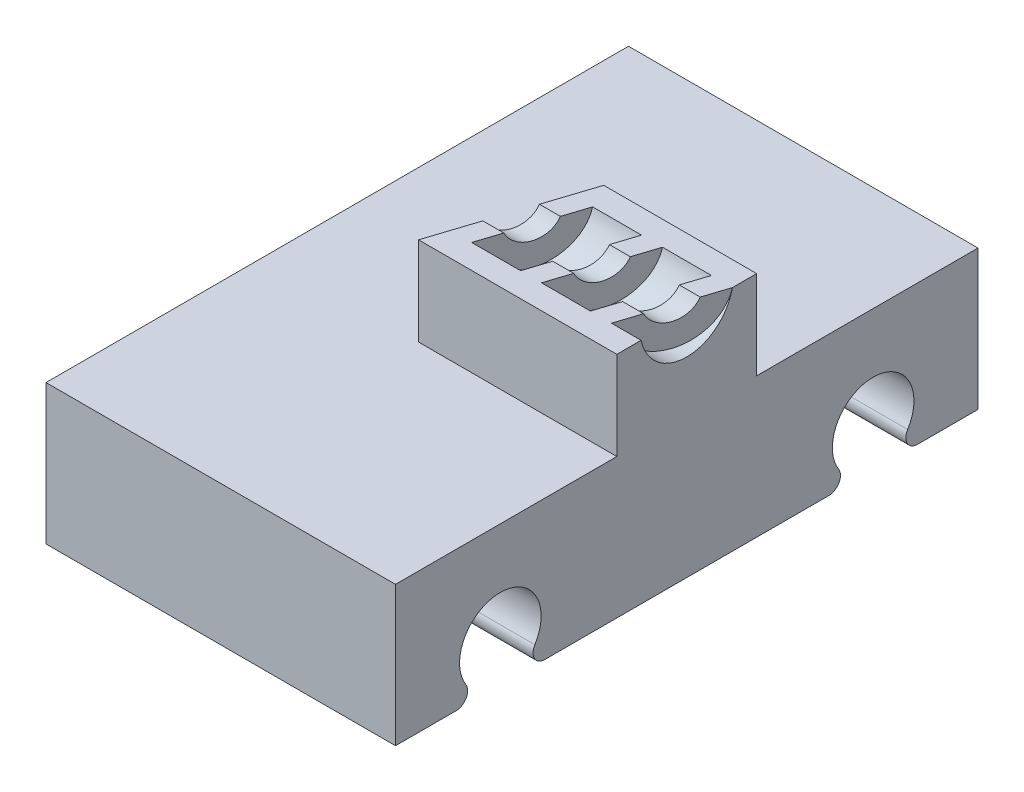
from build123d import *

# Parameters (mm, degrees)
SKETCH_1_W          = 15
SKETCH_1_H          = 25
EXTRUDE_1_DEPTH     = 6
SKETCH_3_R          = 1.75
CUT_EXTRUDE_1_DEPTH = 15
FILLET_1_R          = 0.5
SKETCH_4_W          = 15
SKETCH_4_H          = 6
EXTRUDE_3_DEPTH     = 2.2
EXTRUDE_4_DEPTH     = 15
EXTRUDE_5_REACH     = 32.758
CUT_EXTRUDE_2_REACH = 32.758
SKETCH_8_R          = 1
CUT_EXTRUDE_START   = 6
CUT_EXTRUDE_3_DEPTH = 3.8
SKETCH_10_W         = 8
SKETCH_10_H         = 3.806573262
CUT_EXTRUDE_5_DEPTH = 5
SKETCH_12_R         = 0.9
CUT_EXTRUDE_7_DEPTH = 4


# Read off the part's stored shape, not the designer's step: 切除-拉伸3
with BuildPart() as part:
    # 草图1 → 凸台-拉伸1 (new body)
    with BuildSketch(Plane(origin=(0, 0, 0), x_dir=(1, 0, 0), z_dir=(0, 1, 0))):
        with Locations((7.5, -12.5)):
            Rectangle(SKETCH_1_W, SKETCH_1_H)
    extrude(amount=EXTRUDE_1_DEPTH)

    # 草图3 → 切除-拉伸1 (cut)
    with BuildSketch(Plane(origin=(15, 0, 0), x_dir=(0, 0, -1), z_dir=(1, 0, 0))):
        with Locations((-20.5, 1.7)):
            Circle(SKETCH_3_R)
        with Locations((-4.5, 1.7)):
            Circle(SKETCH_3_R)
    extrude(amount=-CUT_EXTRUDE_1_DEPTH, mode=Mode.SUBTRACT)

    # 圆角1
    fillet_1_edges = [part.edges().sort_by_distance(p)[0] for p in [
        (7.5, 0, 4.084668807),
        (7.5, 0, 4.915331193),
        (7.5, 0, 20.084668807),
        (7.5, 0, 20.915331193),
    ]]
    fillet(fillet_1_edges, radius=FILLET_1_R)

    # 草图4 → 凸台-拉伸3 (add)
    with BuildSketch(Plane(origin=(0, 6, 0), x_dir=(1, 0, 0), z_dir=(0, 1, 0))):
        with Locations((7.5, -12.5)):
            Rectangle(SKETCH_4_W, SKETCH_4_H)
    extrude(amount=EXTRUDE_3_DEPTH)

    # 草图6 → 凸台-拉伸4 (add)
    with BuildSketch(Plane(origin=(15, 0, 0), x_dir=(0, 0, -1), z_dir=(1, 0, 0))):
        with BuildLine():
            ThreePointArc((-10.540408206, 9.8), (-11.235088936, 8.650806662), (-12.5, 8.2))
            Line((-12.5, 8.2), (-9.5, 8.2))
            Line((-9.5, 8.2), (-9.5, 9.8))
            Line((-9.5, 9.8), (-10.540408206, 9.8))
        make_face()
        with BuildLine():
            Line((-15.5, 9.8), (-15.5, 8.2))
            Line((-15.5, 8.2), (-12.5, 8.2))
            ThreePointArc((-12.5, 8.2), (-13.764911064, 8.650806662), (-14.459591794, 9.8))
            Line((-14.459591794, 9.8), (-15.5, 9.8))
        make_face()
    extrude(amount=-EXTRUDE_4_DEPTH)

    # 草图7 → 凸台-拉伸5 (add, up to next)
    with BuildSketch(Plane(origin=(0, 9.8, 0), x_dir=(1, 0, 0), z_dir=(0, 1, 0)), mode=Mode.PRIVATE) as extrude_5_sk1:
        Polygon((14.1, -10.540408206), (15, -10.540408206), (13.726580059, -14.459591794), (12.826580059, -14.459591794), align=None)
    extrude_5_tool1 = extrude(extrude_5_sk1.sketch, amount=-EXTRUDE_5_REACH, mode=Mode.PRIVATE) - part.part
    # 草图7 → 凸台-拉伸5 (add, up to next)
    with BuildSketch(Plane(origin=(0, 9.8, 0), x_dir=(1, 0, 0), z_dir=(0, 1, 0)), mode=Mode.PRIVATE) as extrude_5_sk2:
        Polygon((11.1, -10.540408206), (12, -10.540408206), (10.726580059, -14.459591794), (9.826580059, -14.459591794), align=None)
    extrude_5_tool2 = extrude(extrude_5_sk2.sketch, amount=-EXTRUDE_5_REACH, mode=Mode.PRIVATE) - part.part
    # 草图7 → 凸台-拉伸5 (add, up to next)
    with BuildSketch(Plane(origin=(0, 9.8, 0), x_dir=(1, 0, 0), z_dir=(0, 1, 0)), mode=Mode.PRIVATE) as extrude_5_sk3:
        Polygon((8.1, -10.540408206), (9, -10.540408206), (7.726580059, -14.459591794), (6.826580059, -14.459591794), align=None)
    extrude_5_tool3 = extrude(extrude_5_sk3.sketch, amount=-EXTRUDE_5_REACH, mode=Mode.PRIVATE) - part.part
    # 草图7 → 凸台-拉伸5 (add, up to next)
    with BuildSketch(Plane(origin=(0, 9.8, 0), x_dir=(1, 0, 0), z_dir=(0, 1, 0)), mode=Mode.PRIVATE) as extrude_5_sk4:
        Polygon((5.1, -10.540408206), (6, -10.540408206), (4.726580059, -14.459591794), (3.826580059, -14.459591794), align=None)
    extrude_5_tool4 = extrude(extrude_5_sk4.sketch, amount=-EXTRUDE_5_REACH, mode=Mode.PRIVATE) - part.part
    # 草图7 → 凸台-拉伸5 (add, up to next)
    with BuildSketch(Plane(origin=(0, 9.8, 0), x_dir=(1, 0, 0), z_dir=(0, 1, 0)), mode=Mode.PRIVATE) as extrude_5_sk5:
        Polygon((2.1, -10.540408206), (3, -10.540408206), (1.726580059, -14.459591794), (0.826580059, -14.459591794), align=None)
    extrude_5_tool5 = extrude(extrude_5_sk5.sketch, amount=-EXTRUDE_5_REACH, mode=Mode.PRIVATE) - part.part
    add(extrude_5_tool1.solids().sort_by_distance((13.91329, 9.8, 12.5))[0])
    add(extrude_5_tool2.solids().sort_by_distance((10.91329, 9.8, 12.5))[0])
    add(extrude_5_tool3.solids().sort_by_distance((7.91329, 9.8, 12.5))[0])
    add(extrude_5_tool4.solids().sort_by_distance((4.91329, 9.8, 12.5))[0])
    add(extrude_5_tool5.solids().sort_by_distance((1.91329, 9.8, 12.5))[0])

    # 切除-拉伸2: up to this face of the body (flat: up to its plane)
    cut_extrude_2_end = Plane(part.part.faces().sort_by_distance((0, 3.752278375, 12.5))[0])
    # 草图8 → 切除-拉伸2 (cut, up to the picked face)
    with BuildSketch(Plane(origin=(15, 0, 0), x_dir=(0, 0, -1), z_dir=(1, 0, 0)), mode=Mode.PRIVATE) as cut_extrude_2_sk1:
        with Locations((-12.5, 10.2)):
            Circle(SKETCH_8_R)
    cut_extrude_2_tool1 = split(extrude(cut_extrude_2_sk1.sketch, amount=-CUT_EXTRUDE_2_REACH, mode=Mode.PRIVATE), bisect_by=cut_extrude_2_end, keep=Keep.BOTH, mode=Mode.PRIVATE)
    add(cut_extrude_2_tool1.solids().sort_by(Axis((15, 10.2, 12.5), (-1, 0, 0)))[0], mode=Mode.SUBTRACT)

    # 切除-拉伸3 outline → 切除-拉伸3 (cut)
    with BuildSketch(Plane(origin=(0, 0, 0), x_dir=(1, 0, 0), z_dir=(0, 1, 0)).offset(CUT_EXTRUDE_START)):
        Polygon((6.488530941, -15.5), (8.438049118, -9.5), (0, -9.5), (0, -15.5), align=None)
    extrude(amount=CUT_EXTRUDE_3_DEPTH, mode=Mode.SUBTRACT)

    # 草图10 → 切除-拉伸5 (cut)
    with BuildSketch(Plane.XZ):
        with Locations((7.5, 20.5)):
            Rectangle(SKETCH_10_W, SKETCH_10_H)
        with Locations((7.5, 4.5)):
            Rectangle(SKETCH_10_W, SKETCH_10_H)
    extrude(amount=-CUT_EXTRUDE_5_DEPTH, mode=Mode.SUBTRACT)

    # 草图12 → 切除-拉伸7 (cut)
    with BuildSketch(Plane.XZ):
        with Locations(Location((11.25, 9.451643316, 0), (0, 0, 270))):
            Circle(SKETCH_12_R)
        with Locations(Location((3.75, 15.548356684, 0), (0, 0, 90))):
            Circle(SKETCH_12_R)
    extrude(amount=-CUT_EXTRUDE_7_DEPTH, mode=Mode.SUBTRACT)


solid = part.part
